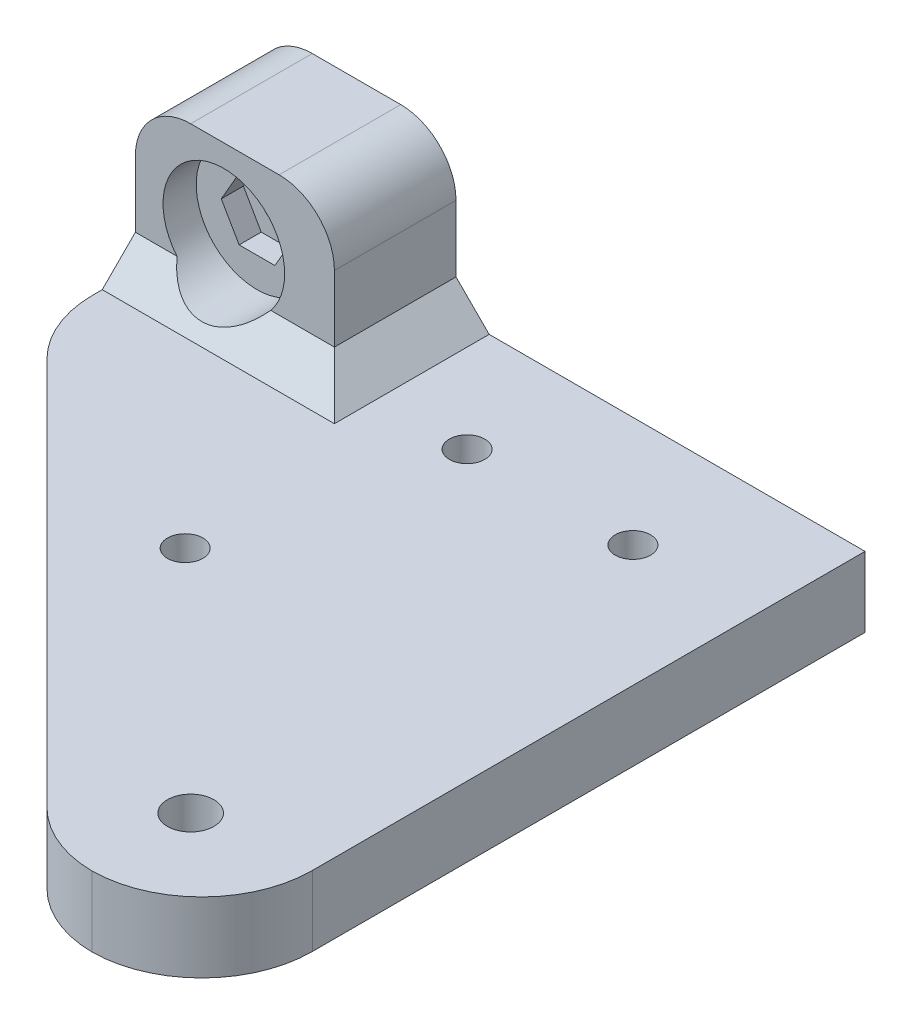
from build123d import *

# Parameters (mm, degrees)
SKETCH1_R           = 2.1
SKETCH1_R_2         = 1.6
BOSS_EXTRUDE1_DEPTH = 6.35
SKETCH2_W           = 18
SKETCH2_H           = 11
BOSS_EXTRUDE2_DEPTH = 14
SKETCH3_R           = 5.5
CUT_EXTRUDE1_DEPTH  = 3
CHAMFER1_SIZE       = 3
FILLET2_R           = 10
FILLET3_R           = 5
CUT_EXTRUDE2_DEPTH  = 2
SKETCH5_R           = 1.6
CUT_EXTRUDE3_DEPTH  = 2638.157111638
SKETCH6_R           = 2.95
CUT_EXTRUDE4_DEPTH  = 3


with BuildPart() as part:
    # Sketch1 → Boss-Extrude1 (new body)
    with BuildSketch(Plane(origin=(251.886129178, -2636.030473787, -0.277944786), x_dir=(1, 0, 0), z_dir=(0, 1, 0))):
        Polygon((-265.886129178, -0.277944786), (-251.886129178, -0.277944786), (-251.886129178, 59.722055214), (-306.886129178, 59.722055214), (-306.886129178, 40.722055214), align=None)
        with Locations(Location((-261.886129178, 8.722055214, 0), (0, 0, 270))):
            Circle(SKETCH1_R, mode=Mode.SUBTRACT)
        with Locations(Location((-282.886129178, 29.222055214, 0), (0, 0, 270))):
            Circle(SKETCH1_R_2, mode=Mode.SUBTRACT)
        with Locations(Location((-262.886129178, 49.722055214, 0), (0, 0, 270))):
            Circle(SKETCH1_R_2, mode=Mode.SUBTRACT)
        with Locations(Location((-277.886129178, 49.722055214, 0), (0, 0, 270))):
            Circle(SKETCH1_R_2, mode=Mode.SUBTRACT)
    extrude(amount=BOSS_EXTRUDE1_DEPTH)

    # Sketch2 → Boss-Extrude2 (add)
    with BuildSketch(Plane(origin=(-55, -2629.680473787, -60), x_dir=(1, 0, 0), z_dir=(0, -1, 0))):
        with Locations((9, 5.5)):
            Rectangle(SKETCH2_W, SKETCH2_H)
    extrude(amount=-BOSS_EXTRUDE2_DEPTH)

    # Sketch3 → Cut-Extrude1 (cut)
    with BuildSketch(Plane.XY.offset(-49)):
        with Locations((-47, -2623.180473787)):
            Circle(SKETCH3_R)
    extrude(amount=-CUT_EXTRUDE1_DEPTH, mode=Mode.SUBTRACT)

    # Chamfer1
    # the kernel refuses this chamfer: 3 mm, written as the material it adds along each edge
    with BuildSketch(Plane(origin=(-37, -2629.680473787, -49), x_dir=(0, -0.02749587661065579, 0.9996219169112949), z_dir=(-1, 0, 0))) as chamfer1_piece_1_section:
        Polygon((CHAMFER1_SIZE * 0.999621916911, CHAMFER1_SIZE * 0.0274958766107), (-CHAMFER1_SIZE * 0.0274958766107, CHAMFER1_SIZE * 0.999621916911), (0, 0), align=None)
    chamfer1_piece_1 = extrude(amount=18, mode=Mode.PRIVATE)
    chamfer1_piece_1 = chamfer1_piece_1 - Plane(origin=(-47, -2623.180473787, -47.945016367), x_dir=(1, 0, 0), z_dir=(0, 0, 1)) * Cylinder(5.5, 48, mode=Mode.PRIVATE)
    add(chamfer1_piece_1)
    with BuildSketch(Plane(origin=(-37, -2629.680473787, -60), x_dir=(0.9996219169112948, -0.027495876610655785, 0), z_dir=(0, 0, 1))) as chamfer1_piece_2:
        Polygon((CHAMFER1_SIZE * 0.999621916911, CHAMFER1_SIZE * 0.0274958766107), (-CHAMFER1_SIZE * 0.0274958766107, CHAMFER1_SIZE * 0.999621916911), (0, 0), align=None)
    extrude(amount=11)
    with BuildSketch(Plane(origin=(-29.284951036, -2629.680473787, -49), x_dir=(0, -0.02749587661065579, 0.9996219169112949), z_dir=(-1, 0, 0))) as chamfer1_piece_3a_section:
        Polygon((CHAMFER1_SIZE * 0.999621916911, CHAMFER1_SIZE * 0.0274958766107), (-CHAMFER1_SIZE * 0.0274958766107, CHAMFER1_SIZE * 0.999621916911), (0, 0), align=None)
    chamfer1_piece_3a = extrude(amount=25.715048964, mode=Mode.PRIVATE)
    chamfer1_piece_3a = split(chamfer1_piece_3a, bisect_by=Plane(origin=(-37, -2628.691092907, -48.01061912), z_dir=(1, 0, 0)), keep=Keep.TOP, mode=Mode.PRIVATE)
    with BuildSketch(Plane(origin=(-37, -2629.680473787, -60), x_dir=(0.9996219169112948, -0.027495876610655785, 0), z_dir=(0, 0, 1))) as chamfer1_piece_3b_section:
        Polygon((CHAMFER1_SIZE * 0.999621916911, CHAMFER1_SIZE * 0.0274958766107), (-CHAMFER1_SIZE * 0.0274958766107, CHAMFER1_SIZE * 0.999621916911), (0, 0), align=None)
    chamfer1_piece_3b = extrude(amount=18.715048964, mode=Mode.PRIVATE)
    chamfer1_piece_3b = split(chamfer1_piece_3b, bisect_by=Plane(origin=(-36.01061912, -2628.691092907, -49), z_dir=(0, 0, 1)), keep=Keep.TOP, mode=Mode.PRIVATE)
    chamfer1_piece_3 = chamfer1_piece_3a & chamfer1_piece_3b
    add(chamfer1_piece_3)

    # Fillet2
    # the kernel refuses this fillet: 10 mm, written as the material it takes off along each edge
    with BuildSketch(Plane(origin=(-14, -2646.385812847, 0), x_dir=(1, 0, 0), z_dir=(0, 1, 0)), Plane(origin=(-55, -2646.385812847, -41), x_dir=(0.7071067811865518, 0, 0.7071067811865432), z_dir=(0, 1, 0))) as fillet2_piece_1:
        with BuildLine():
            CenterArc((FILLET2_R * 0.414213562373, FILLET2_R), FILLET2_R, 225, 45)
            Line((-FILLET2_R * 0.292893218813, FILLET2_R * 0.292893218813), (0, 0))
            Line((0, 0), (FILLET2_R * 0.414213562373, 0))
        make_face()
    extrude(amount=27.060678119, mode=Mode.SUBTRACT)
    with BuildSketch(Plane(origin=(0, -2661.030473787, 0), x_dir=(0, 0, -1), z_dir=(0, 1, 0))) as fillet2_piece_2:
        with BuildLine():
            CenterArc((FILLET2_R, FILLET2_R), FILLET2_R, 180, 90)
            Line((0, FILLET2_R), (0, 0))
            Line((0, 0), (FILLET2_R, 0))
        make_face()
    extrude(amount=56.35, mode=Mode.SUBTRACT)

    # Fillet3
    fillet3_edges = [part.edges().sort_by_distance(p)[0] for p in [
        (-37, -2615.680473787, -54.5),
        (-55, -2615.680473787, -54.5),
    ]]
    fillet(fillet3_edges, radius=FILLET3_R)

    # Sketch4 → Cut-Extrude2 (cut)
    with BuildSketch(Plane.XY.offset(-52)):
        Polygon((-45.383419246, -2625.980473787), (-43.766838493, -2623.180473787), (-45.383419246, -2620.380473787), (-48.616580754, -2620.380473787), (-50.233161507, -2623.180473787), (-48.616580754, -2625.980473787), align=None)
    extrude(amount=-CUT_EXTRUDE2_DEPTH, mode=Mode.SUBTRACT)

    # Sketch5 → Cut-Extrude3 (cut, through all)
    with BuildSketch(Plane.XY.offset(-54)):
        with Locations((-47, -2623.180473787)):
            Circle(SKETCH5_R)
    extrude(amount=-CUT_EXTRUDE3_DEPTH, mode=Mode.SUBTRACT)

    # Sketch6 → Cut-Extrude4 (cut)
    with BuildSketch(Plane(origin=(0, 0, -60), x_dir=(-1, 0, 0), z_dir=(0, 0, -1))):
        with Locations((47, -2623.180473787)):
            Circle(SKETCH6_R)
    extrude(amount=-CUT_EXTRUDE4_DEPTH, mode=Mode.SUBTRACT)


solid = part.part
